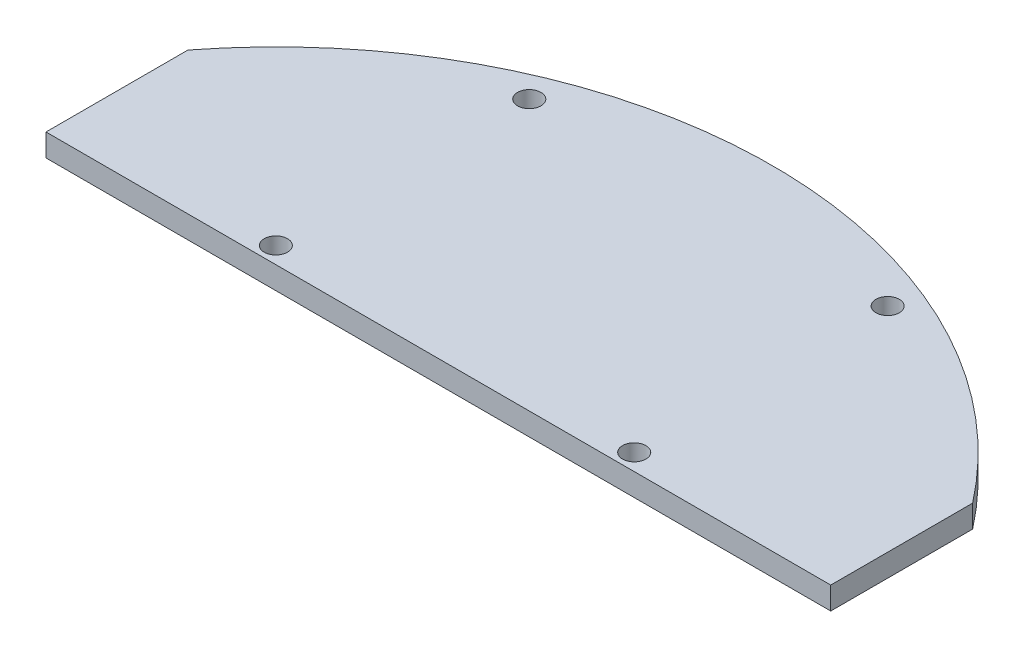
from build123d import *

# Parameters (mm, degrees)
SKETCH1_R           = 1.65
BOSS_EXTRUDE2_DEPTH = 3.175


with BuildPart() as part:
    # Sketch1 → Boss-Extrude2 (new body)
    with BuildSketch(Plane(origin=(0, 0, 0), x_dir=(1, 0, 0), z_dir=(0, 1, 0))):
        with BuildLine():
            Line((-55.306734792, 42.908799641), (-55.306734792, 22.908799641))
            Line((-55.306734792, 22.908799641), (55.306734792, 22.908799641))
            Line((55.306734792, 22.908799641), (55.306734792, 42.908799641))
            ThreePointArc((55.306734792, 42.908799641), (0, 70), (-55.306734792, 42.908799641))
        make_face()
        with Locations((25.257106536, 60.976049146)):
            Circle(SKETCH1_R, mode=Mode.SUBTRACT)
        with Locations((25.257106536, 25.257106536)):
            Circle(SKETCH1_R, mode=Mode.SUBTRACT)
        with Locations((-25.257106536, 25.257106536)):
            Circle(SKETCH1_R, mode=Mode.SUBTRACT)
        with Locations((-25.257106536, 60.976049146)):
            Circle(SKETCH1_R, mode=Mode.SUBTRACT)
    extrude(amount=BOSS_EXTRUDE2_DEPTH)


solid = part.part
